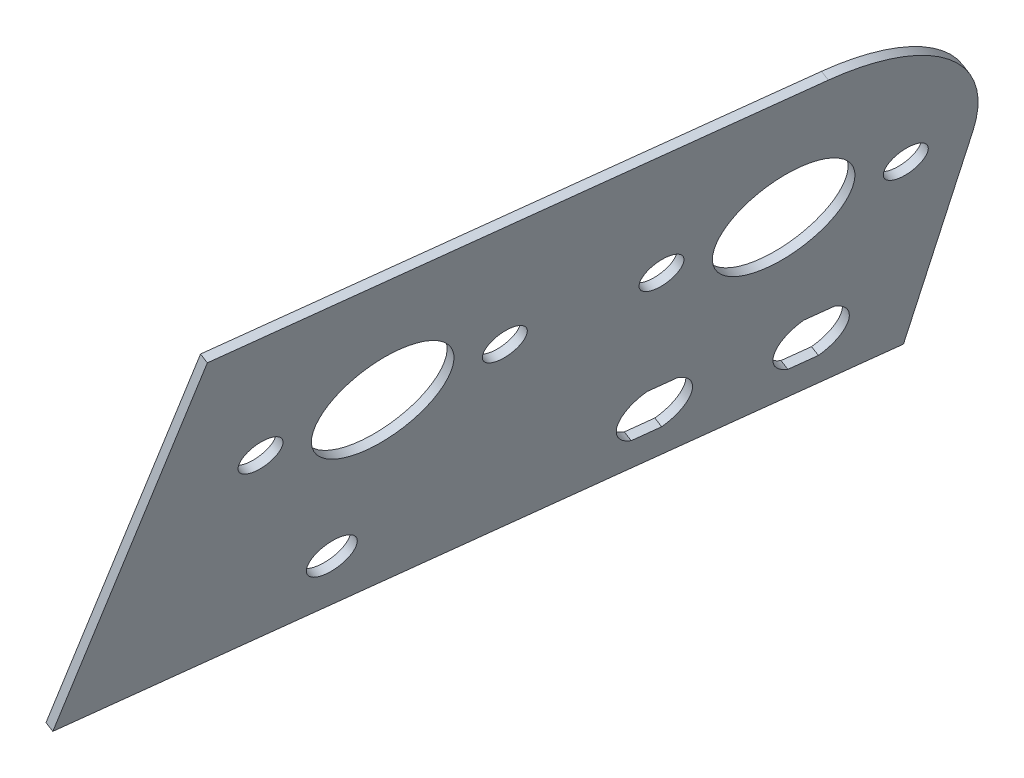
from build123d import *

# Parameters (mm, degrees)
SKETCH39_R          = 11.25
SKETCH39_R_2        = 3.55
SKETCH39_R_3        = 4.024999951
BOSS_EXTRUDE1_DEPTH = 1.5875


with BuildPart() as part:
    # Sketch39 → Boss-Extrude1 (new body)
    with BuildSketch(Plane(origin=(-441.521969452, 172.104793819, -62.182961286), x_dir=(-0.12122181659134343, 0.04725213510134499, 0.9915001295565519), z_dir=(-0.923798474245107, 0.360095662141425, -0.1301056996804562))):
        with BuildLine():
            Line((-227.779978176, 213.473332746), (-90.363815922, 201.963804234))
            Line((-90.363815922, 201.963804234), (-90.363815922, 280.537968932))
            Line((-90.363815922, 280.537968932), (-190.676741831, 288.939851665))
            ThreePointArc((-190.676741831, 288.939851665), (-213.041445426, 281.797087727), (-223.80498218, 260.932157339))
            Line((-223.80498218, 260.932157339), (-227.779978176, 213.473332746))
        make_face()
        with Locations((-128.463815922, 252.946692942)):
            Circle(SKETCH39_R, mode=Mode.SUBTRACT)
        with Locations((-108.73290302, 251.294096181)):
            Circle(SKETCH39_R_2, mode=Mode.SUBTRACT)
        with Locations((-148.194728824, 254.599289703)):
            Circle(SKETCH39_R_2, mode=Mode.SUBTRACT)
        with Locations((-193.237014843, 258.371884328)):
            Circle(SKETCH39_R, mode=Mode.SUBTRACT)
        with Locations((-173.506101941, 256.719287567)):
            Circle(SKETCH39_R_2, mode=Mode.SUBTRACT)
        with Locations((-212.967927745, 260.024481088)):
            Circle(SKETCH39_R_2, mode=Mode.SUBTRACT)
        with Locations((-131.378812986, 218.143554906)):
            Circle(SKETCH39_R_3, mode=Mode.SUBTRACT)
        with BuildLine():
            Line((-210.812041783, 230.315880525), (-205.885245836, 229.903228203))
            ThreePointArc((-205.885245836, 229.903228203), (-202.798738622, 224.125454392), (-206.803355147, 218.941609924))
            Line((-206.803355147, 218.941609924), (-211.730151094, 219.354262246))
            ThreePointArc((-211.730151094, 219.354262246), (-214.816658309, 225.132036057), (-210.812041783, 230.315880525))
        make_face(mode=Mode.SUBTRACT)
        with BuildLine():
            Line((-185.500668667, 228.195882655), (-180.57387272, 227.783230333))
            ThreePointArc((-180.57387272, 227.783230333), (-177.48736551, 222.005456528), (-181.49198203, 216.821612065))
            Line((-181.49198203, 216.821612065), (-186.418777977, 217.234264387))
            ThreePointArc((-186.418777977, 217.234264387), (-189.505285187, 223.012038192), (-185.500668667, 228.195882655))
        make_face(mode=Mode.SUBTRACT)
    extrude(amount=BOSS_EXTRUDE1_DEPTH)


solid = part.part
